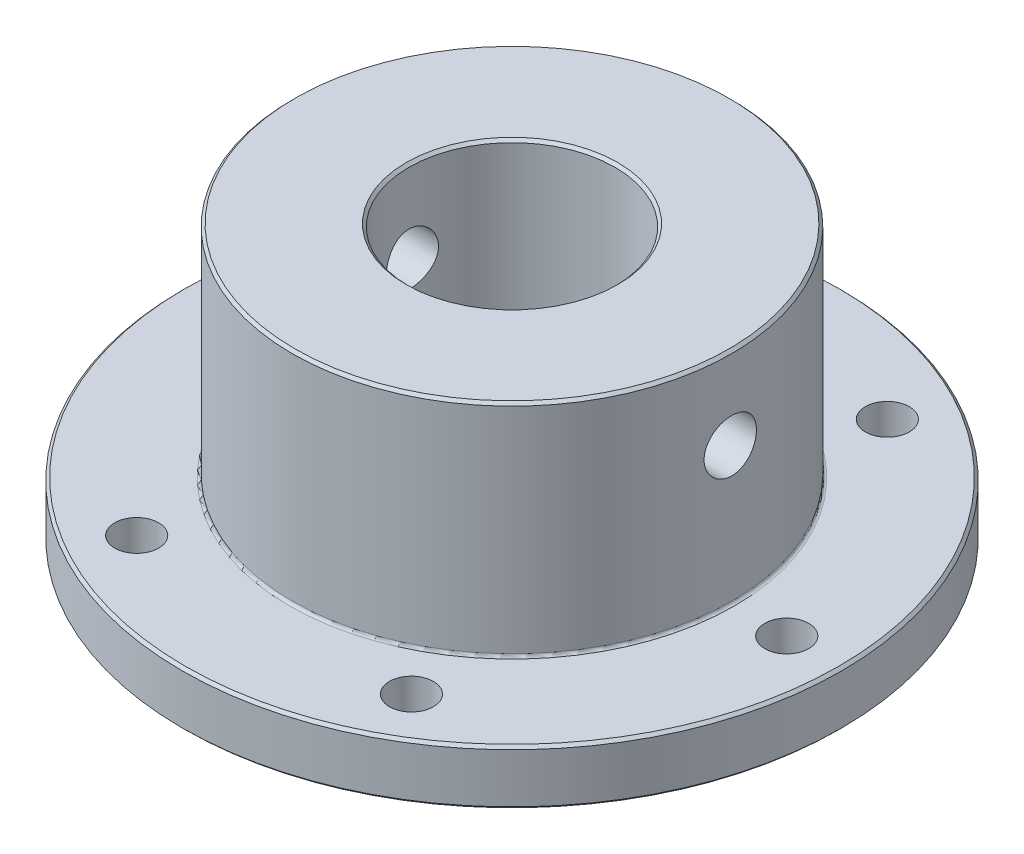
from build123d import *

# Parameters (mm, degrees)
CROQUIS1_R                 = 60
CROQUIS1_R_2               = 18.75
CROQUIS1_R_3               = 4
SALIENTE_EXTRUIR1_DEPTH    = 10
CROQUIS2_R                 = 40
CROQUIS2_R_2               = 18.75
SALIENTE_EXTRUIR2_DEPTH    = 40
CHAFL_N2_SIZE              = 0.5
REDONDEO1_R                = 0.5
CORTAR_EXTRUIR1_DEPTH      = 99.488578018
CORTAR_EXTRUIR1_DEPTH_BACK = 99.488578018
CROQUIS3_R                 = 4.7625


with BuildPart() as part:
    # Croquis1 → Saliente-Extruir1 (new body)
    with BuildSketch(Plane(origin=(0, 0, 0), x_dir=(1, 0, 0), z_dir=(0, 1, 0))):
        Circle(CROQUIS1_R)
        Circle(CROQUIS1_R_2, mode=Mode.SUBTRACT)
        with Locations((25, -43.301270189)):
            Circle(CROQUIS1_R_3, mode=Mode.SUBTRACT)
        with Locations((-25, -43.301270189)):
            Circle(CROQUIS1_R_3, mode=Mode.SUBTRACT)
        with Locations((-50, 0)):
            Circle(CROQUIS1_R_3, mode=Mode.SUBTRACT)
        with Locations((-25, 43.301270189)):
            Circle(CROQUIS1_R_3, mode=Mode.SUBTRACT)
        with Locations((25, 43.301270189)):
            Circle(CROQUIS1_R_3, mode=Mode.SUBTRACT)
        with Locations((50, 0)):
            Circle(CROQUIS1_R_3, mode=Mode.SUBTRACT)
    extrude(amount=SALIENTE_EXTRUIR1_DEPTH)

    # Croquis2 → Saliente-Extruir2 (add)
    with BuildSketch(Plane(origin=(0, 10, 0), x_dir=(1, 0, 0), z_dir=(0, 1, 0))):
        Circle(CROQUIS2_R)
        Circle(CROQUIS2_R_2, mode=Mode.SUBTRACT)
    extrude(amount=SALIENTE_EXTRUIR2_DEPTH)

    # Chaflán2
    chafl_n2_edges = [part.edges().sort_by_distance(p)[0] for p in [
        (-60, 10, 0),
        (-60, 0, 0),
        (-40, 50, 0),
        (-18.75, 50, 0),
    ]]
    chamfer(chafl_n2_edges, length=CHAFL_N2_SIZE)

    # Redondeo1
    redondeo1_edges = [part.edges().sort_by_distance(p)[0] for p in [
        (-40, 10, 0),
    ]]
    fillet(redondeo1_edges, radius=REDONDEO1_R)

    # Croquis3 → Cortar-Extruir1 (cut, two sides: drawn at the far end of the back side and taken through both)
    with BuildSketch(Plane(origin=(0, 0, 0), x_dir=(0, 0, -1), z_dir=(1, 0, 0)).offset(-CORTAR_EXTRUIR1_DEPTH_BACK)):
        with Locations((0, 35)):
            Circle(CROQUIS3_R)
    extrude(amount=CORTAR_EXTRUIR1_DEPTH + CORTAR_EXTRUIR1_DEPTH_BACK, mode=Mode.SUBTRACT)


solid = part.part
